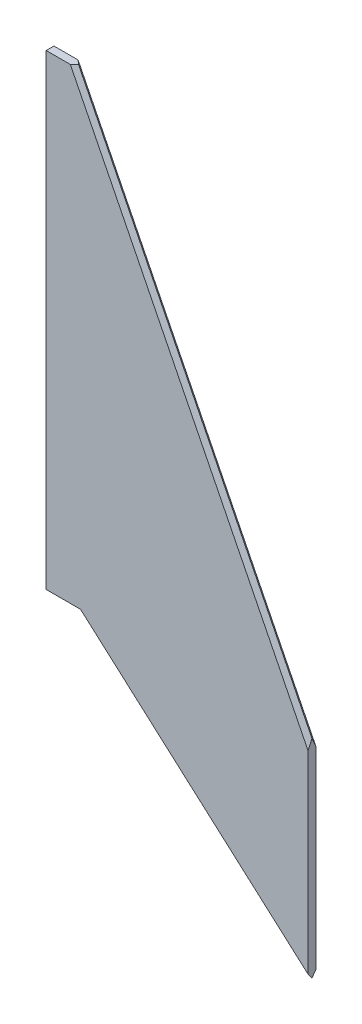
from build123d import *

# Parameters (mm, degrees)
SKETCH1_W           = 11
SKETCH1_H           = 180
BOSS_EXTRUDE1_DEPTH = 1.5
CHAMFER1_SIZE       = 1.5
CHAMFER2_SIZE       = 1.5


with BuildPart() as part:
    # Sketch1 → Boss-Extrude1 (new, symmetric)
    with BuildSketch(Plane.XY):
        Polygon((90, -80), (0, 0), (0, 180), (90, 0), align=None)
        with Locations((-5.5, 90)):
            Rectangle(SKETCH1_W, SKETCH1_H)
    extrude(amount=BOSS_EXTRUDE1_DEPTH, both=True)

    # Chamfer1
    chamfer1_edges = [part.edges().sort_by_distance(p)[0] for p in [
        (45, 90, -1.5),
        (45, 90, 1.5),
    ]]
    chamfer(chamfer1_edges, length=CHAMFER1_SIZE - 0.0001)  # a hair under: the kernel refuses the full size

    # Chamfer2
    chamfer2_edges = [part.edges().sort_by_distance(p)[0] for p in [
        (45, -40, 1.5),
        (45, -40, -1.5),
    ]]
    chamfer(chamfer2_edges, length=CHAMFER2_SIZE - 0.0001)  # a hair under: the kernel refuses the full size


solid = part.part
